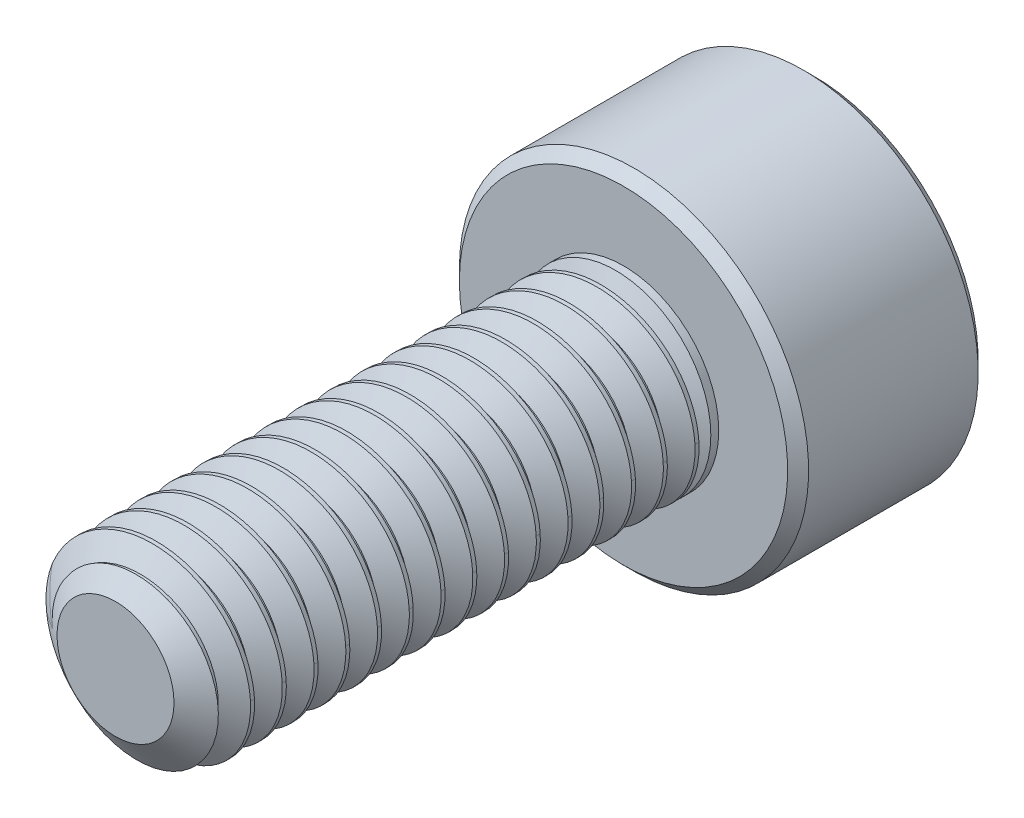
from build123d import *

# Parameters (mm, degrees)
SKETCH1_R          = 1.5
EXTRUDE1_DEPTH     = 8
CUT_SWEEP1_PITCH   = 0.5
SKETCH6_R          = 2.75
EXTRUDE2_DEPTH     = 3
CUT_EXTRUDE1_DEPTH = 1.875
CHAMFER1_SIZE      = 0.165


with BuildPart() as part:
    # Sketch1 → Extrude1 (new body)
    with BuildSketch(Plane.XY):
        Circle(SKETCH1_R)
    extrude(amount=-EXTRUDE1_DEPTH)

    # Cut-Sweep1: the profile of Sketch3 profile screwed along a right-hand helix of 17 turns, 6 arcs to a turn; built about Z, then put on its axis
    cut_sweep1_z = Axis((0, 0, 0), (0, 0, 1))
    cut_sweep1_corners = [(1.5003, 0, -0.437673205), (1.175240474, 0, -0.25), (1.175240474, 0, -0.1875), (1.5003, 0, 0.000173205)]
    with BuildLine(mode=Mode.PRIVATE) as cut_sweep1_profile:
        Line(cut_sweep1_corners[0], cut_sweep1_corners[1])
        Line(cut_sweep1_corners[1], cut_sweep1_corners[2])
        Line(cut_sweep1_corners[2], cut_sweep1_corners[3])
        Line(cut_sweep1_corners[3], cut_sweep1_corners[0])
    cut_sweep1_cap = Face(cut_sweep1_profile.wire())
    cut_sweep1_turn_angles = [0, 30, 60, 90, 120, 150, 180, 210, 240, 270, 300, 330, 360]
    cut_sweep1_turn_weights = [1, 0.8660254037844387, 1, 0.8660254037844387, 1, 0.8660254037844387, 1, 0.8660254037844387, 1, 0.8660254037844387, 1, 0.8660254037844387, 1]
    cut_sweep1_turn_rails = [Edge.make_bspline([Vector(p[0], p[1], 0).rotate(cut_sweep1_z, cut_sweep1_turn_angles[k]) / cut_sweep1_turn_weights[k] + Vector(0, 0, p[2] + CUT_SWEEP1_PITCH * cut_sweep1_turn_angles[k] / 360) for k in range(13)], [0, 0, 0, 1, 1, 2, 2, 3, 3, 4, 4, 5, 5, 6, 6, 6], 2, cut_sweep1_turn_weights) for p in cut_sweep1_corners]
    cut_sweep1_turn_sides = [Face.make_surface_from_curves(cut_sweep1_turn_rails[p[0]], cut_sweep1_turn_rails[p[1]]) for p in [(0, 1), (1, 2), (2, 3), (3, 0)]]
    cut_sweep1 = Plane(origin=(0, 0, 0), x_dir=(0, 1, 0), z_dir=(0, 0, -1)) * Solid(Shell([*[p.moved(Location((0, 0, CUT_SWEEP1_PITCH * i))) for i in range(17) for p in cut_sweep1_turn_sides], cut_sweep1_cap, cut_sweep1_cap.rotate(cut_sweep1_z, 6120).moved(Location((0, 0, CUT_SWEEP1_PITCH * 6120 / 360)))]))
    add(cut_sweep1, mode=Mode.SUBTRACT)

    # Sketch4 → Cut-Revolve1 (revolve, cut)
    with BuildSketch(Plane(origin=(0, 0, 0), x_dir=(0, 0, -1), z_dir=(1, 0, 0)), mode=Mode.PRIVATE) as cut_revolve1_sk:
        Polygon((0.405251783, 1.5), (0, 0.921240474), (0, 1.5), align=None)
    revolve(cut_revolve1_sk.sketch.rotate(Axis((0, 0, 0), (0, 0, -1)), 90), axis=Axis((0, 0, 0), (0, 0, -1)), mode=Mode.SUBTRACT)

    # Sketch6 → Extrude2 (add)
    with BuildSketch(Plane(origin=(0, 0, -8), x_dir=(-1, 0, 0), z_dir=(0, 0, -1))):
        Circle(SKETCH6_R)
    extrude(amount=EXTRUDE2_DEPTH)

    # Sketch7 → Cut-Extrude1 (cut)
    with BuildSketch(Plane(origin=(0, 0, -11), x_dir=(-1, 0, 0), z_dir=(0, 0, -1))):
        Polygon((0, 1.443375673), (-1.25, 0.721687836), (-1.25, -0.721687836), (0, -1.443375673), (1.25, -0.721687836), (1.25, 0.721687836), align=None)
    extrude(amount=-CUT_EXTRUDE1_DEPTH, mode=Mode.SUBTRACT)

    # Cut-Extrude2 cone 1 section (through the dimple's axis) → Cut-Extrude2 (revolve, cut)
    with BuildSketch(Plane(origin=(0, 0, -11), x_dir=(0, 1, 0), z_dir=(1, 0, 0))):
        Polygon((0, 0), (1.443375673, 0), (0, 1.443375673), align=None)
    revolve(axis=Axis((0, 0, -11), (0, 0, 1)), mode=Mode.SUBTRACT)

    # Chamfer1
    chamfer1_edges = [part.edges().sort_by_distance(p)[0] for p in [
        (2.75, 0, -8),
        (2.75, 0, -11),
    ]]
    chamfer(chamfer1_edges, length=CHAMFER1_SIZE)

    # Sketch10 → Revolve1 (revolve)
    with BuildSketch(Plane(origin=(0, 0, 0), x_dir=(0, 0, -1), z_dir=(1, 0, 0)), mode=Mode.PRIVATE) as revolve1_sk:
        Polygon((8, 1.5), (8, 0), (7.253679656, 0), (7.875, 1.5), align=None)
    revolve(revolve1_sk.sketch.rotate(Axis((0, 0, -8), (0, 0, 1)), 270), axis=Axis((0, 0, -8), (0, 0, 1)))


solid = part.part
